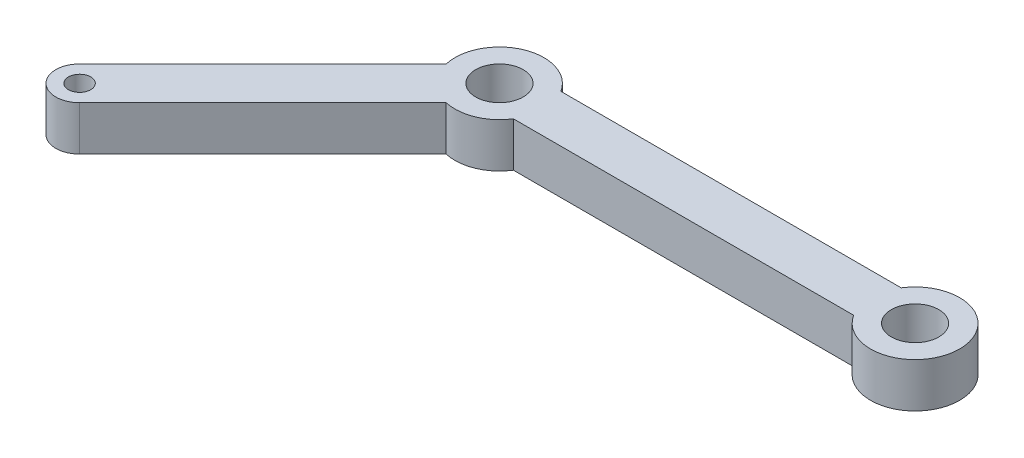
from build123d import *

# Parameters (mm, degrees)
SKETCH_1_R             = 1.6
SKETCH_1_R_2           = 0.75
SM_BASE_FLANGE_1_DEPTH = 3


# Sheet-metal steps are written as plain solids
with BuildPart() as part:
    # Sketch 1 → 基体-法兰1 (new body)
    with BuildSketch(Plane(origin=(0, 0, 0), x_dir=(1, 0, 0), z_dir=(0, 1, 0))):
        with BuildLine():
            Line((-25.462284492, 1.6), (-2.537715508, 1.6))
            ThreePointArc((-2.537715508, 1.6), (3, 0), (-2.537715508, -1.6))
            Line((-2.537715508, -1.6), (-25.462284492, -1.6))
            ThreePointArc((-25.462284492, -1.6), (-26.851949703, -2.771638598), (-28.663064995, -2.925806694))
            Line((-28.663064995, -2.925806694), (-41.010764774, -15.273506474))
            ThreePointArc((-41.010764774, -15.273506474), (-43.273506474, -15.273506474), (-43.273506474, -13.010764774))
            Line((-43.273506474, -13.010764774), (-30.925806694, -0.663064995))
            ThreePointArc((-30.925806694, -0.663064995), (-29.148050297, 2.771638598), (-25.462284492, 1.6))
        make_face()
        with Locations(Location((0, 0, 0), (0, 0, 270))):
            Circle(SKETCH_1_R, mode=Mode.SUBTRACT)
        with Locations(Location((-28, 0, 0), (0, 0, 270))):
            Circle(SKETCH_1_R, mode=Mode.SUBTRACT)
        with Locations(Location((-42.142135624, -14.142135624, 0), (0, 0, 270))):
            Circle(SKETCH_1_R_2, mode=Mode.SUBTRACT)
    extrude(amount=-SM_BASE_FLANGE_1_DEPTH)


solid = part.part
